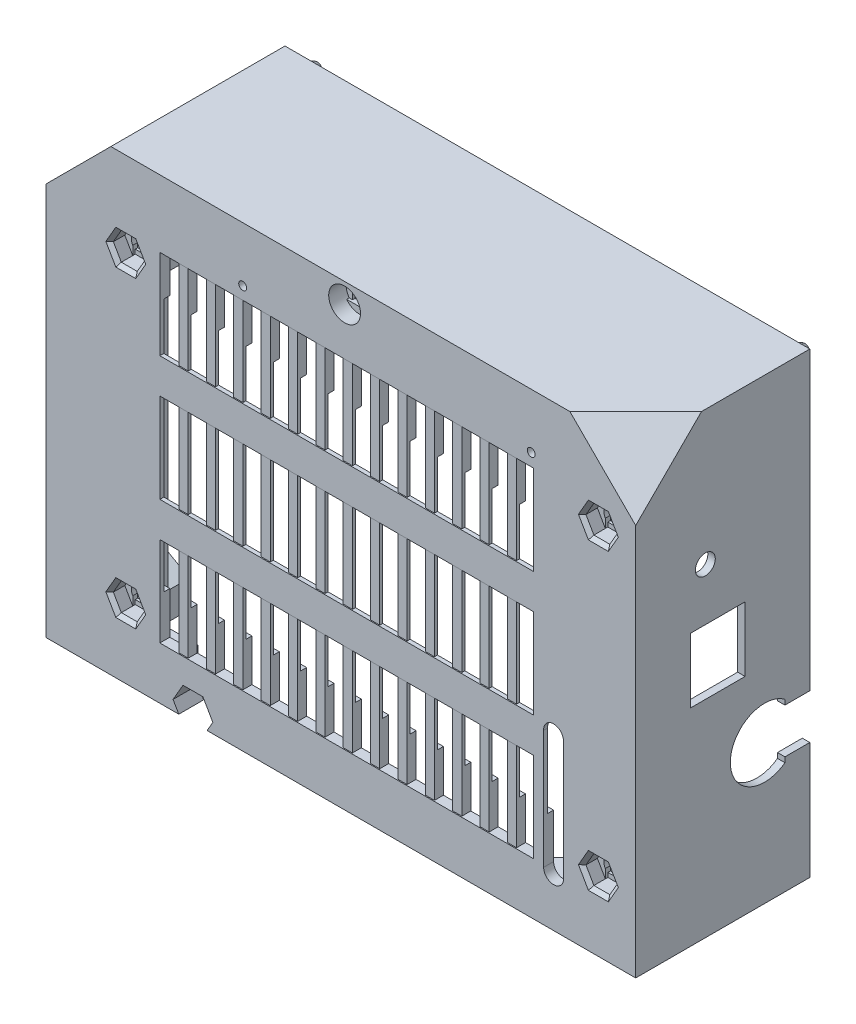
from build123d import *
from OCP.BRepAlgoAPI import BRepAlgoAPI_Cut
from OCP.TopTools import TopTools_ListOfShape

# Parameters (mm, degrees)
BOSS_EXTRUDE1_START          = -2
BOSS_EXTRUDE1_OUTLINE_W      = 3.650000319
BOSS_EXTRUDE1_OUTLINE_H      = 18.000000157
BOSS_EXTRUDE1_OUTLINE_H_2    = 17.999999225
BOSS_EXTRUDE1_OUTLINE_H_3    = 18.000002951
BOSS_EXTRUDE1_OUTLINE_R      = 0.799963803
BOSS_EXTRUDE1_OUTLINE_R_2    = 0.799980855
BOSS_EXTRUDE1_DEPTH          = 2
SKETCH4_W                    = 85.499996319
SKETCH4_H                    = 51.000000909
GRATE_CUT_DEPTH              = 1.2
SKETCH4_3_R                  = 2.500015924
SKETCH4_3_R_2                = 0.799963803
SKETCH4_3_R_3                = 2.549506063
SKETCH4_3_R_4                = 0.799980855
STANDOFF_DEPTH               = 2.5
BOSS_EXTRUDE3_OUTLINE_W      = 4.999995231
BOSS_EXTRUDE3_OUTLINE_H      = 47.999998555
BOSS_EXTRUDE3_OUTLINE_W_2    = 4.499999806
BOSS_EXTRUDE3_DEPTH          = 2
HEXAGON_STANDOFF_DEPTH       = 6
BOSS_EXTRUDE5_DEPTH          = 5
EDGE1_DEPTH                  = 3
OUTER_BORDER_DEPTH           = 33
SKETCH5_R                    = 1.875
HEXAGON_STANDOFF_HOLES_DEPTH = 153.431133443
NUT_START                    = -3
BOTTOM_NUT_INSERT_R          = 1.875
NUT_CUT_1_DEPTH              = 3
BOTTOM_NUT_INSERT_4_W        = 3.2
BOTTOM_NUT_INSERT_4_H        = 0.871281292
NUT_CUT_2_DEPTH              = 3.5
NUT_START_2                  = -4
NUT_CUT_3_DEPTH              = 4
NUT_CHAMFER_SIZE             = 0.7
SKETCH7_W                    = 75.150000319
SKETCH7_H                    = 18.000002951
SKETCH7_H_2                  = 17.999999225
SKETCH7_H_3                  = 18.000000157
GRATE_INLAY_DEPTH            = 0.2
BOSS_EXTRUDE8_OUTLINE_W      = 20.499792424
BOSS_EXTRUDE8_OUTLINE_H      = 3.982051145
BOSS_EXTRUDE8_OUTLINE_W_2    = 23.499999195
BOSS_EXTRUDE8_DEPTH          = 8
CUT_EXTRUDE10_START          = -3.982051145
CUT_EXTRUDE10_DEPTH          = 3.982051145
BOSS_EXTRUDE9_DEPTH          = 4
SKETCH12_R                   = 2.5
SKETCH11_R                   = 1
CUT_EXTRUDE11_DEPTH          = 3
CUT_EXTRUDE12_DEPTH          = 3.5
SKETCH13_4_W                 = 3.8
SKETCH13_4_H                 = 3.8
SKETCH13_4_R                 = 1.875
CUT_EXTRUDE13_DEPTH          = 4
SKETCH13_5_R                 = 1.875
CUT_EXTRUDE14_DEPTH          = 155.758684631
SKETCH15_W                   = 16.201864276
SKETCH15_H                   = 18.704814174
CUT_EXTRUDE15_DEPTH          = 11
CUT_EXTRUDE16_REACH          = 156.759
SKETCH16_R                   = 2
SKETCH16_W                   = 11
SKETCH16_H                   = 13
SKETCH16_W_2                 = 5
SKETCH16_H_2                 = 9


with BuildPart() as part:
    # Boss-Extrude1: read off the stored shape, not the designer's step
    # Boss-Extrude1 outline → Boss-Extrude1 (new body)
    with BuildSketch(Plane.XY.offset(BOSS_EXTRUDE1_START)):
        Polygon((-118.500001729, 0), (-91.845301612, 0), (-93.000002205, 2.000000095), (-91.000001878, 5.464102278), (-87.000001222, 5.464102278), (-85.000000894, 2.000000095), (-86.154701487, 0), (0, 0), (0, 92.000000179), (-105.499997735, 92.000000179), (-118.500001729, 79.000003636), align=None)
        with Locations((-93.825000726, 19.499999937)):
            Rectangle(BOSS_EXTRUDE1_OUTLINE_W, BOSS_EXTRUDE1_OUTLINE_H, mode=Mode.SUBTRACT)
        with Locations((-88.325000726, 19.499999937)):
            Rectangle(BOSS_EXTRUDE1_OUTLINE_W, BOSS_EXTRUDE1_OUTLINE_H, mode=Mode.SUBTRACT)
        with Locations((-82.825000726, 19.499999937)):
            Rectangle(BOSS_EXTRUDE1_OUTLINE_W, BOSS_EXTRUDE1_OUTLINE_H, mode=Mode.SUBTRACT)
        with Locations((-77.325000726, 19.499999937)):
            Rectangle(BOSS_EXTRUDE1_OUTLINE_W, BOSS_EXTRUDE1_OUTLINE_H, mode=Mode.SUBTRACT)
        with Locations((-71.825000726, 19.499999937)):
            Rectangle(BOSS_EXTRUDE1_OUTLINE_W, BOSS_EXTRUDE1_OUTLINE_H, mode=Mode.SUBTRACT)
        with Locations((-66.325000725, 19.499999937)):
            Rectangle(BOSS_EXTRUDE1_OUTLINE_W, BOSS_EXTRUDE1_OUTLINE_H, mode=Mode.SUBTRACT)
        with Locations((-60.825000726, 19.499999937)):
            Rectangle(BOSS_EXTRUDE1_OUTLINE_W, BOSS_EXTRUDE1_OUTLINE_H, mode=Mode.SUBTRACT)
        with Locations((-93.825000726, 44.500000775)):
            Rectangle(BOSS_EXTRUDE1_OUTLINE_W, BOSS_EXTRUDE1_OUTLINE_H_2, mode=Mode.SUBTRACT)
        with Locations((-88.325000726, 44.500000775)):
            Rectangle(BOSS_EXTRUDE1_OUTLINE_W, BOSS_EXTRUDE1_OUTLINE_H_2, mode=Mode.SUBTRACT)
        with Locations((-82.825000726, 44.500000775)):
            Rectangle(BOSS_EXTRUDE1_OUTLINE_W, BOSS_EXTRUDE1_OUTLINE_H_2, mode=Mode.SUBTRACT)
        with Locations((-77.325000726, 44.500000775)):
            Rectangle(BOSS_EXTRUDE1_OUTLINE_W, BOSS_EXTRUDE1_OUTLINE_H_2, mode=Mode.SUBTRACT)
        with Locations((-71.825000726, 44.500000775)):
            Rectangle(BOSS_EXTRUDE1_OUTLINE_W, BOSS_EXTRUDE1_OUTLINE_H_2, mode=Mode.SUBTRACT)
        with Locations((-66.325000725, 44.500000775)):
            Rectangle(BOSS_EXTRUDE1_OUTLINE_W, BOSS_EXTRUDE1_OUTLINE_H_2, mode=Mode.SUBTRACT)
        with Locations((-60.825000726, 44.500000775)):
            Rectangle(BOSS_EXTRUDE1_OUTLINE_W, BOSS_EXTRUDE1_OUTLINE_H_2, mode=Mode.SUBTRACT)
        with Locations((-55.325000726, 19.499999937)):
            Rectangle(BOSS_EXTRUDE1_OUTLINE_W, BOSS_EXTRUDE1_OUTLINE_H, mode=Mode.SUBTRACT)
        with Locations((-49.825000726, 19.499999937)):
            Rectangle(BOSS_EXTRUDE1_OUTLINE_W, BOSS_EXTRUDE1_OUTLINE_H, mode=Mode.SUBTRACT)
        with Locations((-44.325000726, 19.499999937)):
            Rectangle(BOSS_EXTRUDE1_OUTLINE_W, BOSS_EXTRUDE1_OUTLINE_H, mode=Mode.SUBTRACT)
        with Locations((-38.825000726, 19.499999937)):
            Rectangle(BOSS_EXTRUDE1_OUTLINE_W, BOSS_EXTRUDE1_OUTLINE_H, mode=Mode.SUBTRACT)
        with Locations((-33.325000726, 19.499999937)):
            Rectangle(BOSS_EXTRUDE1_OUTLINE_W, BOSS_EXTRUDE1_OUTLINE_H, mode=Mode.SUBTRACT)
        with Locations((-27.825000726, 19.499999937)):
            Rectangle(BOSS_EXTRUDE1_OUTLINE_W, BOSS_EXTRUDE1_OUTLINE_H, mode=Mode.SUBTRACT)
        with Locations((-22.325000726, 19.499999937)):
            Rectangle(BOSS_EXTRUDE1_OUTLINE_W, BOSS_EXTRUDE1_OUTLINE_H, mode=Mode.SUBTRACT)
        with BuildLine():
            ThreePointArc((-14.499999583, 10.009994654), (-16.506024467, 8.000042335), (-18.500000238, 10.02194856))
            Line((-18.500000238, 10.02194856), (-18.500000238, 33.868484596))
            ThreePointArc((-18.500000238, 33.868484596), (-16.572791073, 35.987917421), (-14.510190205, 34.000001848))
            Line((-14.510190205, 34.000001848), (-14.499999583, 34.000001848))
            Line((-14.499999583, 34.000001848), (-14.499999583, 10.009994654))
        make_face(mode=Mode.SUBTRACT)
        with Locations((-55.325000726, 44.500000775)):
            Rectangle(BOSS_EXTRUDE1_OUTLINE_W, BOSS_EXTRUDE1_OUTLINE_H_2, mode=Mode.SUBTRACT)
        with Locations((-49.825000726, 44.500000775)):
            Rectangle(BOSS_EXTRUDE1_OUTLINE_W, BOSS_EXTRUDE1_OUTLINE_H_2, mode=Mode.SUBTRACT)
        with Locations((-44.325000726, 44.500000775)):
            Rectangle(BOSS_EXTRUDE1_OUTLINE_W, BOSS_EXTRUDE1_OUTLINE_H_2, mode=Mode.SUBTRACT)
        with Locations((-38.825000726, 44.500000775)):
            Rectangle(BOSS_EXTRUDE1_OUTLINE_W, BOSS_EXTRUDE1_OUTLINE_H_2, mode=Mode.SUBTRACT)
        with Locations((-33.325000726, 44.500000775)):
            Rectangle(BOSS_EXTRUDE1_OUTLINE_W, BOSS_EXTRUDE1_OUTLINE_H_2, mode=Mode.SUBTRACT)
        with Locations((-27.825000726, 44.500000775)):
            Rectangle(BOSS_EXTRUDE1_OUTLINE_W, BOSS_EXTRUDE1_OUTLINE_H_2, mode=Mode.SUBTRACT)
        with Locations((-22.325000726, 44.500000775)):
            Rectangle(BOSS_EXTRUDE1_OUTLINE_W, BOSS_EXTRUDE1_OUTLINE_H_2, mode=Mode.SUBTRACT)
        with Locations((-93.825000726, 69.500001148)):
            Rectangle(BOSS_EXTRUDE1_OUTLINE_W, BOSS_EXTRUDE1_OUTLINE_H_3, mode=Mode.SUBTRACT)
        with Locations((-88.325000726, 69.500001148)):
            Rectangle(BOSS_EXTRUDE1_OUTLINE_W, BOSS_EXTRUDE1_OUTLINE_H_3, mode=Mode.SUBTRACT)
        with Locations((-82.825000726, 69.500001148)):
            Rectangle(BOSS_EXTRUDE1_OUTLINE_W, BOSS_EXTRUDE1_OUTLINE_H_3, mode=Mode.SUBTRACT)
        with Locations((-77.325000726, 69.500001148)):
            Rectangle(BOSS_EXTRUDE1_OUTLINE_W, BOSS_EXTRUDE1_OUTLINE_H_3, mode=Mode.SUBTRACT)
        with Locations((-71.825000726, 69.500001148)):
            Rectangle(BOSS_EXTRUDE1_OUTLINE_W, BOSS_EXTRUDE1_OUTLINE_H_3, mode=Mode.SUBTRACT)
        with Locations((-66.325000725, 69.500001148)):
            Rectangle(BOSS_EXTRUDE1_OUTLINE_W, BOSS_EXTRUDE1_OUTLINE_H_3, mode=Mode.SUBTRACT)
        with Locations((-60.825000726, 69.500001148)):
            Rectangle(BOSS_EXTRUDE1_OUTLINE_W, BOSS_EXTRUDE1_OUTLINE_H_3, mode=Mode.SUBTRACT)
        with Locations((-78.999961347, 81.000023497)):
            Circle(BOSS_EXTRUDE1_OUTLINE_R, mode=Mode.SUBTRACT)
        with Locations((-55.325000726, 69.500001148)):
            Rectangle(BOSS_EXTRUDE1_OUTLINE_W, BOSS_EXTRUDE1_OUTLINE_H_3, mode=Mode.SUBTRACT)
        with Locations((-49.825000726, 69.500001148)):
            Rectangle(BOSS_EXTRUDE1_OUTLINE_W, BOSS_EXTRUDE1_OUTLINE_H_3, mode=Mode.SUBTRACT)
        with Locations((-44.325000726, 69.500001148)):
            Rectangle(BOSS_EXTRUDE1_OUTLINE_W, BOSS_EXTRUDE1_OUTLINE_H_3, mode=Mode.SUBTRACT)
        with Locations((-38.825000726, 69.500001148)):
            Rectangle(BOSS_EXTRUDE1_OUTLINE_W, BOSS_EXTRUDE1_OUTLINE_H_3, mode=Mode.SUBTRACT)
        with Locations((-33.325000726, 69.500001148)):
            Rectangle(BOSS_EXTRUDE1_OUTLINE_W, BOSS_EXTRUDE1_OUTLINE_H_3, mode=Mode.SUBTRACT)
        with Locations((-27.825000726, 69.500001148)):
            Rectangle(BOSS_EXTRUDE1_OUTLINE_W, BOSS_EXTRUDE1_OUTLINE_H_3, mode=Mode.SUBTRACT)
        with Locations((-22.325000726, 69.500001148)):
            Rectangle(BOSS_EXTRUDE1_OUTLINE_W, BOSS_EXTRUDE1_OUTLINE_H_3, mode=Mode.SUBTRACT)
        with Locations((-21.000008639, 80.999997241)):
            Circle(BOSS_EXTRUDE1_OUTLINE_R_2, mode=Mode.SUBTRACT)
    extrude(amount=BOSS_EXTRUDE1_DEPTH)

    # Sketch4 → Grate Cut (cut)
    with BuildSketch(Plane(origin=(0, 0, -2), x_dir=(-1, 0, 0), z_dir=(0, 0, -1))):
        with Locations((54.7499974, 44.482050799)):
            Rectangle(SKETCH4_W, SKETCH4_H)
    extrude(amount=-GRATE_CUT_DEPTH, mode=Mode.SUBTRACT)

    # Sketch4<3> → Standoff (add)
    # profile 1 of 2: a face of its own
    with BuildSketch(Plane(origin=(0, 0, -2), x_dir=(-1, 0, 0), z_dir=(0, 0, -1))):
        with Locations(Location((78.999960482, 80.982074452, 0), (0, 0, 263.131100986))):
            Circle(SKETCH4_3_R)
        with Locations(Location((78.999960482, 80.982074452, 0), (0, 0, 179.35444573))):
            Circle(SKETCH4_3_R_2, mode=Mode.SUBTRACT)
    # profile 2 of 2: a face of its own
    with BuildSketch(Plane(origin=(0, 0, -2), x_dir=(-1, 0, 0), z_dir=(0, 0, -1))):
        with Locations(Location((21.000007775, 80.982048196, 0), (0, 0, 258.689885708))):
            Circle(SKETCH4_3_R_3)
        with Locations(Location((21.000007775, 80.982048196, 0), (0, 0, 179.354459432))):
            Circle(SKETCH4_3_R_4, mode=Mode.SUBTRACT)
    extrude(amount=STANDOFF_DEPTH)

    # Boss-Extrude3: read off the stored shape, not the designer's step
    # Boss-Extrude3 outline → Boss-Extrude3 (add)
    # profile 1 of 4: a face of its own
    with BuildSketch(Plane(origin=(0, 0, -2), x_dir=(-1, 0, 0), z_dir=(0, 0, -1))):
        Polygon((106.999999911, 90.499998863), (105.499997735, 92.000000179), (105.500210992, 87.55315036), (103.929287021, 85.981978237), (99.606892298, 85.981770948), (98.000209305, 87.588292395), (98.000209305, 77.883969962), (102.499751549, 80.481888442), (106.999999911, 77.883775408), align=None)
    # profile 2 of 4: a face of its own
    with BuildSketch(Plane(origin=(0, 0, -2), x_dir=(-1, 0, 0), z_dir=(0, 0, -1))):
        Polygon((102.499946911, 69.482219428), (98.000209305, 72.080037589), (98.000209305, 16.883967311), (102.499753162, 19.481884963), (106.999999911, 16.8837711), (106.999999911, 72.080432805), align=None)
        with Locations((102.499998242, 44.982049948)):
            Rectangle(BOSS_EXTRUDE3_OUTLINE_W, BOSS_EXTRUDE3_OUTLINE_H, mode=Mode.SUBTRACT)
    # profile 3 of 4: a face of its own
    with BuildSketch(Plane(origin=(0, 0, -2), x_dir=(-1, 0, 0), z_dir=(0, 0, -1))):
        Polygon((102.499945298, 8.482217811), (98.000209305, 11.0800368), (98.000209305, 3.982051145), (106.999999911, 3.982051145), (106.999999911, 11.08043036), align=None)
    # profile 4 of 4: a face of its own
    with BuildSketch(Plane(origin=(0, 0, -2), x_dir=(-1, 0, 0), z_dir=(0, 0, -1))):
        Polygon((8.999998748, 70.218942881), (4.750022776, 70.21891897), (1.499999149, 70.218949913), (1.499999149, 18.7320517), (4.742383155, 18.7320517), (4.749976748, 18.745204188), (8.999998748, 18.745204188), align=None)
        with Locations((5.249999065, 44.982049948)):
            Rectangle(BOSS_EXTRUDE3_OUTLINE_W_2, BOSS_EXTRUDE3_OUTLINE_H, mode=Mode.SUBTRACT)
    extrude(amount=BOSS_EXTRUDE3_DEPTH)

    # Sketch4<5> → Hexagon Standoff (add)
    with BuildSketch(Plane(origin=(0, 0, -2), x_dir=(-1, 0, 0), z_dir=(0, 0, -1))):
        Polygon((97.736901671, 72.232052087), (102.499946911, 69.482219428), (107.26289447, 72.232221275), (107.262796789, 77.732055783), (102.499751549, 80.481888442), (97.73680399, 77.731886594), align=None)
        Polygon((97.736901671, 11.232051402), (102.499945298, 8.482217811), (107.262892857, 11.232217796), (107.262796789, 16.732051372), (102.499753162, 19.481884963), (97.736805603, 16.731884977), align=None)
        Polygon((10.249999419, 70.218949913), (12.999960943, 74.982084878), (10.249945824, 79.7451889), (4.749969181, 79.745157956), (2.000007657, 74.982022992), (4.750022776, 70.21891897), align=None)
        Polygon((12.999999404, 13.982051387), (10.249991852, 18.745204188), (4.749976748, 18.745204188), (1.999969196, 13.982051387), (4.749976748, 9.218898585), (10.249991852, 9.218898585), align=None)
    extrude(amount=HEXAGON_STANDOFF_DEPTH)

    # Boss-Extrude5: read off the stored shape, not the designer's step
    # Boss-Extrude5 outline → Boss-Extrude5 (add)
    with BuildSketch(Plane(origin=(0, 0, -2), x_dir=(-1, 0, 0), z_dir=(0, 0, -1))):
        Polygon((5.499999106, 3.982051145), (12.999999404, 3.982051145), (12.999999404, 13.982051387), (10.249991852, 9.218898585), (4.749976748, 9.218898585), (1.999969196, 13.982051387), (4.742383155, 18.7320517), (1.499999149, 18.7320517), (1.499999149, 6.982051171), (2.49999908, 6.982051171), align=None)
        Polygon((3.928929169, 84.982051849), (1.499999149, 84.982051849), (1.499999149, 70.232048034), (4.74240917, 70.232048034), (2.000007657, 74.982022992), (4.749969181, 79.745157956), (10.249945824, 79.7451889), (12.999960943, 74.982084878), (12.999960943, 89.982054531), (5.499999106, 89.982054531), (5.499999106, 86.553148329), align=None)
    extrude(amount=BOSS_EXTRUDE5_DEPTH)

    # Sketch4<7> → Edge1 (add)
    with BuildSketch(Plane(origin=(0, 0, -2), x_dir=(-1, 0, 0), z_dir=(0, 0, -1))):
        Polygon((28.999998301, 2.982050981), (28.999998301, 0), (86.154701487, 0), (85.000000894, 2.000000095), (87.000001222, 5.464102278), (91.000001878, 5.464102278), (93.000002205, 2.000000095), (91.845301612, 0), (98.000209305, 0), (98.000209305, 2.982050981), (94.422697157, 2.982050981), (91.999999315, 7.178200743), (86.000002056, 7.178200743), (83.577296764, 2.982050981), align=None)
    extrude(amount=EDGE1_DEPTH)

    # Sketch4<8> → Outer Border (add)
    with BuildSketch(Plane(origin=(0, 0, -2), x_dir=(-1, 0, 0), z_dir=(0, 0, -1))):
        Polygon((0, 0), (5.499999106, 0), (5.499999106, 3.982051145), (2.49999908, 6.982051171), (1.499999149, 6.982051171), (1.499999149, 18.7320517), (1.499999149, 70.218949913), (1.499999149, 70.232048034), (1.499999149, 84.982051849), (3.928929169, 84.982051849), (5.499999106, 86.553148329), (5.499999106, 89.982054531), (12.999960943, 89.982054531), (53.999962075, 89.982054531), (53.999962075, 86.553148329), (56.571060582, 83.982049822), (60.657860501, 83.982049822), (63.499962701, 86.824148297), (63.499962701, 88.482051491), (68.928858055, 88.482051491), (69.499959959, 89.053153395), (69.499959959, 89.982054531), (98.000209305, 89.982054531), (98.000209305, 87.588292395), (99.606892298, 85.981770948), (103.929287021, 85.981978237), (105.500210992, 87.55315036), (105.499998596, 91.982051133), (105.499997735, 92.000000179), (0, 92.000000179), align=None)
    extrude(amount=OUTER_BORDER_DEPTH)

    # Sketch5 → Hexagon Standoff Holes (cut, through all)
    with BuildSketch(Plane(origin=(0, 0, -8), x_dir=(-1, 0, 0), z_dir=(0, 0, -1))):
        with Locations((7.4999843, 74.982053935)):
            Circle(SKETCH5_R)
        with Locations((7.4999843, 13.982051387)):
            Circle(SKETCH5_R)
        with Locations((102.49984923, 74.982053935)):
            Circle(SKETCH5_R)
        with Locations((102.49984923, 13.982051387)):
            Circle(SKETCH5_R)
    extrude(amount=-HEXAGON_STANDOFF_HOLES_DEPTH, mode=Mode.SUBTRACT)

    # Bottom Nut Insert → Nut Cut 1 (cut)
    with BuildSketch(Plane.XY.offset(NUT_START)):
        with Locations(Location((-102.49984923, 74.982053935, 0), (0, 0, 180))):
            Circle(BOTTOM_NUT_INSERT_R)
        Polygon((-100.89984923, 77.753335227), (-100.89984923, 72.210772643), (-99.29984923, 74.982053935), align=None)
        with Locations(Location((-102.49984923, 74.982053935, 0), (0, 0, 180))):
            Circle(BOTTOM_NUT_INSERT_R)
        Polygon((-104.09984923, 77.753335227), (-104.09984923, 72.210772643), (-105.69984923, 74.982053935), align=None)
        with BuildLine():
            Line((-5.8999843, 77.753335227), (-5.8999843, 76.882053935))
            Line((-5.8999843, 76.882053935), (-5.8999843, 75.959614675))
            ThreePointArc((-5.8999843, 75.959614675), (-5.695043165, 75.489806335), (-5.6249843, 74.982053935))
            ThreePointArc((-5.6249843, 74.982053935), (-5.695043165, 74.474301535), (-5.8999843, 74.004493195))
            Line((-5.8999843, 74.004493195), (-5.8999843, 73.082053935))
            Line((-5.8999843, 73.082053935), (-5.8999843, 72.210772643))
            Line((-5.8999843, 72.210772643), (-4.2999843, 74.982053935))
            Line((-4.2999843, 74.982053935), (-5.8999843, 77.753335227))
        make_face()
        with BuildLine():
            Line((-9.0999843, 75.959614675), (-9.0999843, 76.882053935))
            Line((-9.0999843, 76.882053935), (-9.0999843, 77.753335227))
            Line((-9.0999843, 77.753335227), (-10.6999843, 74.982053935))
            Line((-10.6999843, 74.982053935), (-9.0999843, 72.210772643))
            Line((-9.0999843, 72.210772643), (-9.0999843, 73.082053935))
            Line((-9.0999843, 73.082053935), (-9.0999843, 74.004493195))
            ThreePointArc((-9.0999843, 74.004493195), (-9.3749843, 74.982053935), (-9.0999843, 75.959614675))
        make_face()
        with Locations(Location((-7.4999843, 13.982051387, 0), (0, 0, 180))):
            Circle(BOTTOM_NUT_INSERT_R)
        Polygon((-5.8999843, 11.210770095), (-5.8999843, 16.753332679), (-4.2999843, 13.982051387), align=None)
        with Locations(Location((-7.4999843, 13.982051387, 0), (0, 0, 180))):
            Circle(BOTTOM_NUT_INSERT_R)
        Polygon((-9.0999843, 11.210770095), (-9.0999843, 16.753332679), (-10.6999843, 13.982051387), align=None)
        with BuildLine():
            Line((-100.89984923, 13.004490647), (-100.89984923, 12.082051387))
            Line((-100.89984923, 12.082051387), (-100.89984923, 11.210770095))
            Line((-100.89984923, 11.210770095), (-99.29984923, 13.982051387))
            Line((-99.29984923, 13.982051387), (-100.89984923, 16.753332679))
            Line((-100.89984923, 16.753332679), (-100.89984923, 15.882051387))
            Line((-100.89984923, 15.882051387), (-100.89984923, 14.959612127))
            ThreePointArc((-100.89984923, 14.959612127), (-100.694908095, 14.489803787), (-100.62484923, 13.982051387))
            ThreePointArc((-100.62484923, 13.982051387), (-100.694908095, 13.474298986), (-100.89984923, 13.004490647))
        make_face()
        with BuildLine():
            Line((-104.09984923, 11.210770095), (-104.09984923, 12.082051387))
            Line((-104.09984923, 12.082051387), (-104.09984923, 13.004490647))
            ThreePointArc((-104.09984923, 13.004490647), (-104.37484923, 13.982051387), (-104.09984923, 14.959612127))
            Line((-104.09984923, 14.959612127), (-104.09984923, 15.882051387))
            Line((-104.09984923, 15.882051387), (-104.09984923, 16.753332679))
            Line((-104.09984923, 16.753332679), (-105.69984923, 13.982051387))
            Line((-105.69984923, 13.982051387), (-104.09984923, 11.210770095))
        make_face()
    extrude(amount=NUT_CUT_1_DEPTH, mode=Mode.SUBTRACT)

    # Bottom Nut Insert<4> → Nut Cut 2 (cut)
    with BuildSketch(Plane.XY):
        with Locations((-102.49984923, 77.317694581)):
            Rectangle(BOTTOM_NUT_INSERT_4_W, BOTTOM_NUT_INSERT_4_H)
        with Locations((-102.49984923, 72.646413289)):
            Rectangle(BOTTOM_NUT_INSERT_4_W, BOTTOM_NUT_INSERT_4_H)
        with Locations((-102.49984923, 16.317692033)):
            Rectangle(BOTTOM_NUT_INSERT_4_W, BOTTOM_NUT_INSERT_4_H)
        with Locations((-102.49984923, 11.646410741)):
            Rectangle(BOTTOM_NUT_INSERT_4_W, BOTTOM_NUT_INSERT_4_H)
        with Locations((-7.4999843, 16.317692033)):
            Rectangle(BOTTOM_NUT_INSERT_4_W, BOTTOM_NUT_INSERT_4_H)
        with Locations((-7.4999843, 11.646410741)):
            Rectangle(BOTTOM_NUT_INSERT_4_W, BOTTOM_NUT_INSERT_4_H)
        with Locations((-7.4999843, 77.317694581)):
            Rectangle(BOTTOM_NUT_INSERT_4_W, BOTTOM_NUT_INSERT_4_H)
        with Locations((-7.4999843, 72.646413289)):
            Rectangle(BOTTOM_NUT_INSERT_4_W, BOTTOM_NUT_INSERT_4_H)
    extrude(amount=-NUT_CUT_2_DEPTH, mode=Mode.SUBTRACT)

    # Bottom Nut Insert<5> → Nut Cut 3 (cut)
    with BuildSketch(Plane.XY.offset(NUT_START_2)):
        with BuildLine():
            Line((-100.89984923, 75.959614675), (-100.89984923, 76.882053935))
            Line((-100.89984923, 76.882053935), (-104.09984923, 76.882053935))
            Line((-104.09984923, 76.882053935), (-104.09984923, 75.959614675))
            ThreePointArc((-104.09984923, 75.959614675), (-102.49984923, 76.857053935), (-100.89984923, 75.959614675))
        make_face()
        with BuildLine():
            Line((-104.09984923, 73.082053935), (-100.89984923, 73.082053935))
            Line((-100.89984923, 73.082053935), (-100.89984923, 74.004493195))
            ThreePointArc((-100.89984923, 74.004493195), (-102.49984923, 73.107053935), (-104.09984923, 74.004493195))
            Line((-104.09984923, 74.004493195), (-104.09984923, 73.082053935))
        make_face()
        with BuildLine():
            Line((-5.8999843, 75.959614675), (-5.8999843, 76.882053935))
            Line((-5.8999843, 76.882053935), (-9.0999843, 76.882053935))
            Line((-9.0999843, 76.882053935), (-9.0999843, 75.959614675))
            ThreePointArc((-9.0999843, 75.959614675), (-7.4999843, 76.857053935), (-5.8999843, 75.959614675))
        make_face()
        with BuildLine():
            Line((-5.8999843, 73.082053935), (-5.8999843, 74.004493195))
            ThreePointArc((-5.8999843, 74.004493195), (-7.4999843, 73.107053935), (-9.0999843, 74.004493195))
            Line((-9.0999843, 74.004493195), (-9.0999843, 73.082053935))
            Line((-9.0999843, 73.082053935), (-5.8999843, 73.082053935))
        make_face()
        with BuildLine():
            Line((-5.8999843, 15.882051387), (-9.0999843, 15.882051387))
            Line((-9.0999843, 15.882051387), (-9.0999843, 14.959612127))
            ThreePointArc((-9.0999843, 14.959612127), (-7.4999843, 15.857051387), (-5.8999843, 14.959612127))
            Line((-5.8999843, 14.959612127), (-5.8999843, 15.882051387))
        make_face()
        with BuildLine():
            Line((-9.0999843, 13.004490647), (-9.0999843, 12.082051387))
            Line((-9.0999843, 12.082051387), (-5.8999843, 12.082051387))
            Line((-5.8999843, 12.082051387), (-5.8999843, 13.004490647))
            ThreePointArc((-5.8999843, 13.004490647), (-7.4999843, 12.107051387), (-9.0999843, 13.004490647))
        make_face()
        with BuildLine():
            Line((-104.09984923, 15.882051387), (-104.09984923, 14.959612127))
            ThreePointArc((-104.09984923, 14.959612127), (-102.49984923, 15.857051387), (-100.89984923, 14.959612127))
            Line((-100.89984923, 14.959612127), (-100.89984923, 15.882051387))
            Line((-100.89984923, 15.882051387), (-104.09984923, 15.882051387))
        make_face()
        with BuildLine():
            Line((-104.09984923, 13.004490647), (-104.09984923, 12.082051387))
            Line((-104.09984923, 12.082051387), (-100.89984923, 12.082051387))
            Line((-100.89984923, 12.082051387), (-100.89984923, 13.004490647))
            ThreePointArc((-100.89984923, 13.004490647), (-102.49984923, 12.107051387), (-104.09984923, 13.004490647))
        make_face()
    extrude(amount=NUT_CUT_3_DEPTH, mode=Mode.SUBTRACT)

    # Nut Chamfer
    nut_chamfer_edges = [part.edges().sort_by_distance(p)[0] for p in [
        (-5.0999843, 12.596410741, 0),
        (-5.0999843, 15.367692033, 0),
        (-9.8999843, 73.596413289, 0),
        (-9.8999843, 76.367694581, 0),
        (-5.0999843, 76.367694581, 0),
        (-5.0999843, 73.596413289, 0),
        (-104.89984923, 76.367694581, 0),
        (-104.89984923, 73.596413289, 0),
        (-9.8999843, 15.367692033, 0),
        (-9.8999843, 12.596410741, 0),
        (-100.09984923, 15.367692033, 0),
        (-100.09984923, 12.596410741, 0),
        (-104.89984923, 12.596410741, 0),
        (-104.89984923, 15.367692033, 0),
        (-100.09984923, 73.596413289, 0),
        (-100.09984923, 76.367694581, 0),
        (-7.4999843, 16.753332679, 0),
        (-102.49984923, 11.210770095, 0),
        (-102.49984923, 16.753332679, 0),
        (-102.49984923, 72.210772643, 0),
        (-7.4999843, 72.210772643, 0),
        (-7.4999843, 77.753335227, 0),
        (-7.4999843, 11.210770095, 0),
        (-102.49984923, 77.753335227, 0),
    ]]
    chamfer(nut_chamfer_edges, length=NUT_CHAMFER_SIZE)

    # Sketch7 → Grate Inlay (cut)
    with BuildSketch(Plane.XY):
        with Locations((-58.075000726, 69.500001148)):
            Rectangle(SKETCH7_W, SKETCH7_H)
        with Locations((-58.075000726, 44.500000775)):
            Rectangle(SKETCH7_W, SKETCH7_H_2)
        with Locations((-58.075000726, 19.499999937)):
            Rectangle(SKETCH7_W, SKETCH7_H_3)
    extrude(amount=-GRATE_INLAY_DEPTH, mode=Mode.SUBTRACT)

    # Boss-Extrude8: read off the stored shape, not the designer's step
    # Boss-Extrude8 outline → Boss-Extrude8 (add)
    with BuildSketch(Plane(origin=(0, 0, -2), x_dir=(-1, 0, 0), z_dir=(0, 0, -1))):
        with Locations((108.250105517, 1.991025573)):
            Rectangle(BOSS_EXTRUDE8_OUTLINE_W, BOSS_EXTRUDE8_OUTLINE_H)
        with Locations((17.249998704, 1.991025573)):
            Rectangle(BOSS_EXTRUDE8_OUTLINE_W_2, BOSS_EXTRUDE8_OUTLINE_H)
    extrude(amount=BOSS_EXTRUDE8_DEPTH)


with BuildPart() as cut_extrude10_tool:
    # Cut-Extrude10: read off the stored shape, not the designer's step
    # Cut-Extrude10 outline → Cut-Extrude10 (new body)
    with BuildSketch(Plane.XZ.offset(CUT_EXTRUDE10_START)):
        Polygon((-28.999998301, -10), (-23.999998301, -10), (-28.999998301, -5), align=None)
        with BuildLine():
            Line((-17.849999106, -7), (-17.949999106, -10))
            Line((-17.949999106, -10), (-15.049999106, -10))
            Line((-15.049999106, -10), (-15.149999106, -7))
            Line((-15.149999106, -7), (-15.149999106, -5.858778202))
            ThreePointArc((-15.149999106, -5.858778202), (-16.499999106, -3.4), (-17.849999106, -5.858778202))
            Line((-17.849999106, -5.858778202), (-17.849999106, -7))
        make_face()
        with BuildLine():
            Line((-109.30000006, -7), (-109.30000006, -5.858778202))
            ThreePointArc((-109.30000006, -5.858778202), (-110.65000006, -3.4), (-112.00000006, -5.858778202))
            Line((-112.00000006, -5.858778202), (-112.00000006, -7))
            Line((-112.00000006, -7), (-112.10000006, -10))
            Line((-112.10000006, -10), (-109.20000006, -10))
            Line((-109.20000006, -10), (-109.30000006, -7))
        make_face()
        Polygon((-118.500000864, -10), (-114.500000864, -10), (-118.500000864, -6), align=None)
    extrude(amount=CUT_EXTRUDE10_DEPTH)


with BuildPart() as part_1:
    add(part.part)

    # Cut-Extrude10: cut by cut_extrude10_tool, with a tolerance
    cut_extrude10_stock = TopTools_ListOfShape()
    cut_extrude10_stock.Append(part_1.part.wrapped)
    cut_extrude10_tools = TopTools_ListOfShape()
    cut_extrude10_tools.Append(cut_extrude10_tool.part.wrapped)
    cut_extrude10_cut = BRepAlgoAPI_Cut()
    cut_extrude10_cut.SetArguments(cut_extrude10_stock)
    cut_extrude10_cut.SetTools(cut_extrude10_tools)
    cut_extrude10_cut.SetFuzzyValue(0.00001)
    cut_extrude10_cut.Build()
    add(Compound.cast(cut_extrude10_cut.Shape()).solids(), mode=Mode.REPLACE)

    # Sketch10 → Boss-Extrude9 (add)
    with BuildSketch(Plane(origin=(0, 0, -35), x_dir=(-1, 0, 0), z_dir=(0, 0, -1))):
        with BuildLine():
            Line((5.283515839, 86.336661404), (3.928929169, 84.982051849))
            Line((3.928929169, 84.982051849), (5.949999149, 84.982051849))
            Line((5.949999149, 84.982051849), (7.999999149, 86.982054531))
            Line((7.999999149, 86.982054531), (7.999999149, 89.982054531))
            Line((7.999999149, 89.982054531), (5.999972494, 89.982054531))
            ThreePointArc((5.999972494, 89.982054531), (6.371698084, 89.272611164), (6.499996045, 88.48202313))
            ThreePointArc((6.499996045, 88.48202313), (6.174714358, 87.248896917), (5.283515839, 86.336661404))
        make_face()
        with BuildLine():
            ThreePointArc((5.999972494, 89.982054531), (1.54692457, 88.964143802), (5.283515839, 86.336661404))
            Line((5.283515839, 86.336661404), (5.499999106, 86.553148329))
            Line((5.499999106, 86.553148329), (5.499999106, 89.982054531))
            Line((5.499999106, 89.982054531), (5.999972494, 89.982054531))
        make_face()
        with BuildLine():
            Line((5.499999106, 86.553148329), (5.283515839, 86.336661404))
            ThreePointArc((5.283515839, 86.336661404), (6.174714358, 87.248896917), (6.499996045, 88.48202313))
            ThreePointArc((6.499996045, 88.48202313), (6.371698084, 89.272611164), (5.999972494, 89.982054531))
            Line((5.999972494, 89.982054531), (5.499999106, 89.982054531))
            Line((5.499999106, 89.982054531), (5.499999106, 86.553148329))
        make_face()
    extrude(amount=-BOSS_EXTRUDE9_DEPTH)

    # Sketch12 → Loft1 section 0
    with BuildSketch(Plane(origin=(0, 0, -35), x_dir=(-1, 0, 0), z_dir=(0, 0, -1))):
        with Locations((3.999996045, 88.48202313)):
            Circle(SKETCH12_R)
    # Sketch11 → Loft1 section 1
    with BuildSketch(Plane(origin=(0, 0, -38), x_dir=(-1, 0, 0), z_dir=(0, 0, -1))):
        with Locations((3.999996045, 88.48202313)):
            Circle(SKETCH11_R)
    loft()

    # Loft2: read off the stored shape, not the designer's step
    # Loft2: loft between two sections, ruled curve by curve
    loft2_from = [
        Edge.make_bspline([(-101.810029876, 85.989395824, -35), (-106.795586747, 85.609629204, -35), (-107.175353367, 90.595186075, -35), (-102.189796496, 90.974952695, -35), (-97.204239625, 91.354719315, -35), (-96.824473005, 86.369162444, -35), (-101.810029876, 85.989395824, -35)], [0, 0, 0, 0, 0.5, 0.5, 0.5, 1, 1, 1, 1], 3, [1, 0.333333333, 0.333333333, 1, 0.333333333, 0.333333333, 1]),
    ]
    loft2_to = [
        Edge.make_bspline([(-102.137703477, 87.491712834, -38), (-104.118626328, 87.767293415, -38), (-103.843045747, 89.748216266, -38), (-101.862122896, 89.472635685, -38), (-99.881200044, 89.197055104, -38), (-100.156780626, 87.216132252, -38), (-102.137703477, 87.491712834, -38)], [0, 0, 0, 0, 0.5, 0.5, 0.5, 1, 1, 1, 1], 3, [1, 0.333333333, 0.333333333, 1, 0.333333333, 0.333333333, 1]),
    ]
    loft2 = Solid(Shell([*[Face.make_surface_from_curves(loft2_from[k], loft2_to[k]) for k in range(1)], Face(Wire(loft2_from)), Face(Wire(loft2_to))]))
    add(loft2)

    # Sketch13 → Cut-Extrude11 (cut)
    with BuildSketch(Plane.XY):
        with BuildLine():
            Line((-60.411443466, 89.908299119), (-56.611443466, 89.908299119))
            Line((-56.611443466, 89.908299119), (-55.936564828, 89.908299119))
            ThreePointArc((-55.936564828, 89.908299119), (-58.511443466, 91.208299119), (-61.086322104, 89.908299119))
            Line((-61.086322104, 89.908299119), (-60.411443466, 89.908299119))
        make_face()
        with BuildLine():
            ThreePointArc((-61.086322104, 86.108299119), (-58.511443466, 84.808299119), (-55.936564828, 86.108299119))
            Line((-55.936564828, 86.108299119), (-56.611443466, 86.108299119))
            Line((-56.611443466, 86.108299119), (-60.411443466, 86.108299119))
            Line((-60.411443466, 86.108299119), (-61.086322104, 86.108299119))
        make_face()
    extrude(amount=-CUT_EXTRUDE11_DEPTH, mode=Mode.SUBTRACT)

    # Sketch13<3> → Cut-Extrude12 (cut)
    with BuildSketch(Plane.XY):
        with BuildLine():
            ThreePointArc((-61.086322104, 89.908299119), (-61.711443466, 88.008299119), (-61.086322104, 86.108299119))
            Line((-61.086322104, 86.108299119), (-60.411443466, 86.108299119))
            Line((-60.411443466, 86.108299119), (-60.411443466, 89.908299119))
            Line((-60.411443466, 89.908299119), (-61.086322104, 89.908299119))
        make_face()
        with BuildLine():
            Line((-56.611443466, 86.108299119), (-55.936564828, 86.108299119))
            ThreePointArc((-55.936564828, 86.108299119), (-55.471738575, 87.008202034), (-55.311443466, 88.008299119))
            ThreePointArc((-55.311443466, 88.008299119), (-55.471738575, 89.008396204), (-55.936564828, 89.908299119))
            Line((-55.936564828, 89.908299119), (-56.611443466, 89.908299119))
            Line((-56.611443466, 89.908299119), (-56.611443466, 86.108299119))
        make_face()
    extrude(amount=-CUT_EXTRUDE12_DEPTH, mode=Mode.SUBTRACT)

    # Sketch13<4> → Cut-Extrude13 (cut)
    with BuildSketch(Plane.XY):
        with Locations((-58.511443466, 88.008299119)):
            Rectangle(SKETCH13_4_W, SKETCH13_4_H)
        with Locations((-58.511443466, 88.008299119)):
            Circle(SKETCH13_4_R, mode=Mode.SUBTRACT)
    extrude(amount=-CUT_EXTRUDE13_DEPTH, mode=Mode.SUBTRACT)

    # Sketch13<5> → Cut-Extrude14 (cut, through all)
    with BuildSketch(Plane.XY):
        with Locations((-58.511443466, 88.008299119)):
            Circle(SKETCH13_5_R)
    extrude(amount=-CUT_EXTRUDE14_DEPTH, mode=Mode.SUBTRACT)

    # Sketch15 → Cut-Extrude15 (cut)
    with BuildSketch(Plane(origin=(26.262795765, 26.262793916, 26.255450017), x_dir=(0.40817217861234223, 0.4081721498711258, -0.816572696504382), z_dir=(0.5774041113588274, 0.5774040707012381, 0.5772426104538391))):
        with Locations((40.254162498, 65.053826286)):
            Rectangle(SKETCH15_W, SKETCH15_H)
    extrude(amount=CUT_EXTRUDE15_DEPTH, mode=Mode.SUBTRACT)

    # Sketch16 → Cut-Extrude16 (cut, up to next)
    with BuildSketch(Plane(origin=(0, 0, 0), x_dir=(0, 0, -1), z_dir=(1, 0, 0)), mode=Mode.PRIVATE) as cut_extrude16_sk1:
        with Locations(Location((14, 65, 0), (0, 0, 90))):
            Circle(SKETCH16_R)
    cut_extrude16_tool1 = extrude(cut_extrude16_sk1.sketch, amount=-CUT_EXTRUDE16_REACH, mode=Mode.PRIVATE) & part_1.part
    # Sketch16 → Cut-Extrude16 (cut, up to next)
    with BuildSketch(Plane(origin=(0, 0, 0), x_dir=(0, 0, -1), z_dir=(1, 0, 0)), mode=Mode.PRIVATE) as cut_extrude16_sk2:
        with Locations((16.5, 48)):
            Rectangle(SKETCH16_W, SKETCH16_H)
    cut_extrude16_tool2 = extrude(cut_extrude16_sk2.sketch, amount=-CUT_EXTRUDE16_REACH, mode=Mode.PRIVATE) & part_1.part
    # Sketch16 → Cut-Extrude16 (cut, up to next)
    with BuildSketch(Plane(origin=(0, 0, 0), x_dir=(0, 0, -1), z_dir=(1, 0, 0)), mode=Mode.PRIVATE) as cut_extrude16_sk3:
        with BuildLine():
            ThreePointArc((30, 33.518661523), (19.025, 28), (30, 22.481338477))
            Line((30, 22.481338477), (30, 23.504707197))
            Line((30, 23.504707197), (30, 32.504707197))
            Line((30, 32.504707197), (30, 33.518661523))
        make_face()
    cut_extrude16_tool3 = extrude(cut_extrude16_sk3.sketch, amount=-CUT_EXTRUDE16_REACH, mode=Mode.PRIVATE) & part_1.part
    # Sketch16 → Cut-Extrude16 (cut, up to next)
    with BuildSketch(Plane(origin=(0, 0, 0), x_dir=(0, 0, -1), z_dir=(1, 0, 0)), mode=Mode.PRIVATE) as cut_extrude16_sk4:
        with Locations((32.5, 28.004707197)):
            Rectangle(SKETCH16_W_2, SKETCH16_H_2)
    cut_extrude16_tool4 = extrude(cut_extrude16_sk4.sketch, amount=-CUT_EXTRUDE16_REACH, mode=Mode.PRIVATE) & part_1.part
    add(cut_extrude16_tool1.solids().sort_by_distance((0, 65, -14))[0], mode=Mode.SUBTRACT)
    add(cut_extrude16_tool2.solids().sort_by_distance((0, 48, -16.5))[0], mode=Mode.SUBTRACT)
    add(cut_extrude16_tool3.solids().sort_by_distance((0, 28, -25.018221))[0], mode=Mode.SUBTRACT)
    add(cut_extrude16_tool4.solids().sort_by_distance((0, 28.004707, -32.5))[0], mode=Mode.SUBTRACT)


solid = part_1.part
